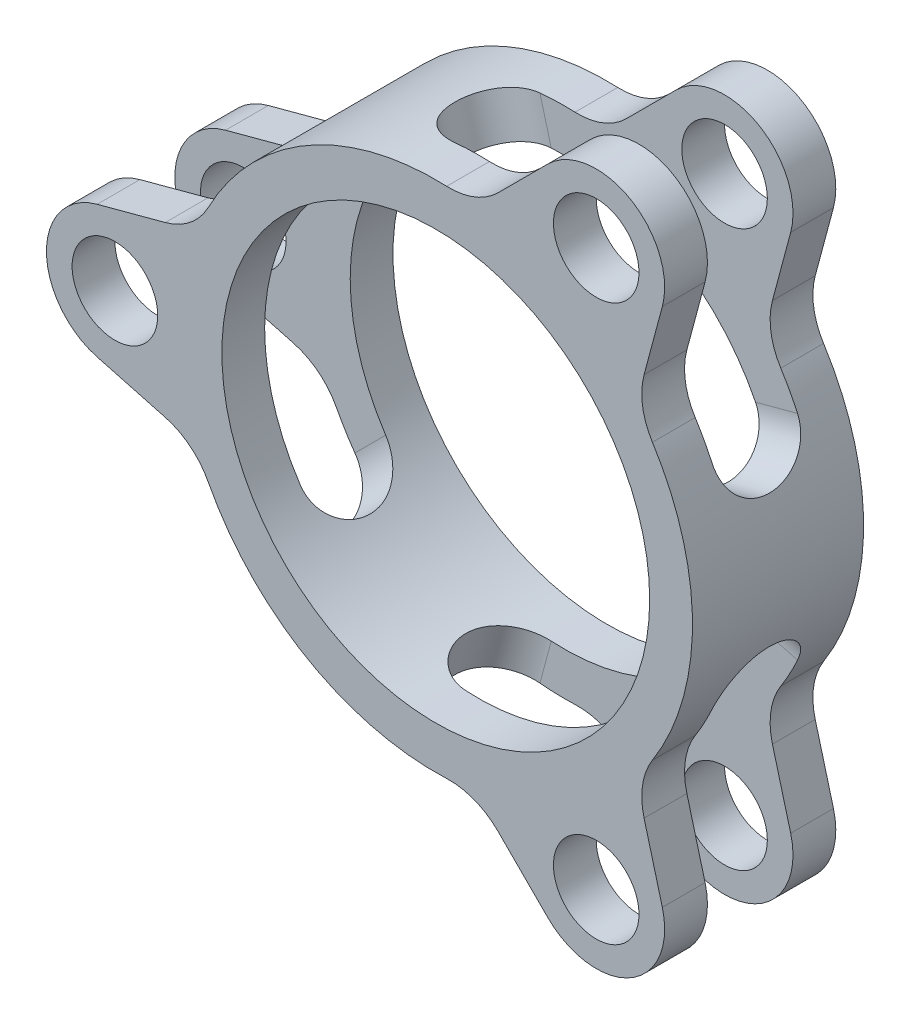
from build123d import *

# Parameters (mm, degrees)
SKETCH1_R               = 30
SKETCH1_R_2             = 25
BOSS_EXTRUDE1_DEPTH     = 10
SKETCH1_5_R             = 5
BOSS_EXTRUDE2_DEPTH     = 10
FILLET1_R               = 8
CUT_EXTRUDE1_DEPTH      = 5
FILLET3_R               = 5
FILLET4_R               = 5
CIRPATTERN1_START       = -10
CIRPATTERN1_OUTLINE_R   = 5
CIRPATTERN1_DEPTH       = 5
CIRPATTERN1_START_2     = 5
CIRPATTERN1_2_OUTLINE_R = 5
CIRPATTERN1_2_DEPTH     = 5
CIRPATTERN1_START_3     = 7.695043188
CIRPATTERN1_3_DEPTH     = 23.304956812
CIRPATTERN1_START_4     = -31
CIRPATTERN1_4_DEPTH     = 22.44392041
CIRPATTERN1_START_5     = 19.696614876
CIRPATTERN1_5_DEPTH     = 11.303385124
CIRPATTERN1_6_DEPTH     = 21.640337448
CIRPATTERN1_START_6     = 19.154924917
CIRPATTERN1_7_DEPTH     = 11.845075083
CIRPATTERN1_START_7     = 6.846405715
CIRPATTERN1_8_DEPTH     = 24.153594285


with BuildPart() as part:
    # Sketch1 → Boss-Extrude1 (new, symmetric)
    with BuildSketch(Plane.XY):
        Circle(SKETCH1_R)
        Circle(SKETCH1_R_2, mode=Mode.SUBTRACT)
    extrude(amount=BOSS_EXTRUDE1_DEPTH, both=True)

    # Sketch1<5> → Boss-Extrude2 (add, symmetric)
    with BuildSketch(Plane.XY):
        with BuildLine():
            ThreePointArc((-27.975291142, -10.83434749), (-30, 0), (-27.975291142, 10.83434749))
            Line((-27.975291142, 10.83434749), (-39.570552361, 7.72740661))
            ThreePointArc((-39.570552361, 7.72740661), (-45.5, 0), (-39.570552361, -7.72740661))
            Line((-39.570552361, -7.72740661), (-27.975291142, -10.83434749))
        make_face()
        with Locations((-37.5, 0)):
            Circle(SKETCH1_5_R, mode=Mode.SUBTRACT)
    extrude(amount=BOSS_EXTRUDE2_DEPTH, both=True)

    # Fillet1
    fillet1_edges = [part.edges().sort_by_distance(p)[0] for p in [
        (-27.975291142, 10.83434749, 0),
        (-27.975291142, -10.83434749, 0),
    ]]
    fillet(fillet1_edges, radius=FILLET1_R)

    # Sketch2 → Cut-Extrude1 (cut, symmetric)
    with BuildSketch(Plane.XY):
        Polygon((0, 0), (-49.927013172, 49.927013172), (-49.927013172, -49.927013172), align=None)
    extrude(amount=CUT_EXTRUDE1_DEPTH, both=True, mode=Mode.SUBTRACT)

    # Fillet3
    fillet3_edges = [part.edges().sort_by_distance(p)[0] for p in [
        (-19.445436483, 19.445436483, -5),
        (-19.445436483, 19.445436483, 5),
    ]]
    fillet(fillet3_edges, radius=FILLET3_R - 0.0001)  # a hair under: the kernel refuses the full size

    # Fillet4
    fillet4_edges = [part.edges().sort_by_distance(p)[0] for p in [
        (-19.445436483, -19.445436483, -5),
        (-19.445436483, -19.445436483, 5),
    ]]
    fillet(fillet4_edges, radius=FILLET4_R - 0.0001)  # a hair under: the kernel refuses the full size

    # CirPattern1: read off the stored shape, not the designer's step
    # CirPattern1 outline → CirPattern1 (add)
    # profile 1 of 2: a face of its own
    with BuildSketch(Plane.XY.offset(CIRPATTERN1_START)):
        with BuildLine():
            ThreePointArc((1.272952374, 29.972981037), (15, 25.980762113), (25.320886818, 16.088899612))
            ThreePointArc((25.320886818, 16.088899612), (24.165509274, 19.166985596), (24.345716693, 22.449825203))
            Line((24.345716693, 22.449825203), (26.47740661, 30.405400281))
            ThreePointArc((26.47740661, 30.405400281), (22.75, 39.404155872), (13.093145751, 38.132806891))
            Line((13.093145751, 38.132806891), (7.26926059, 32.308921731))
            ThreePointArc((7.26926059, 32.308921731), (4.516341804, 30.511437725), (1.272952374, 29.972981037))
        make_face()
        with Locations((18.75, 32.475952642)):
            Circle(CIRPATTERN1_OUTLINE_R, mode=Mode.SUBTRACT)
    # profile 2 of 2: a face of its own
    with BuildSketch(Plane.XY.offset(CIRPATTERN1_START)):
        with BuildLine():
            Line((7.26926059, -32.308921731), (13.093145751, -38.132806891))
            ThreePointArc((13.093145751, -38.132806891), (22.75, -39.404155872), (26.47740661, -30.405400281))
            Line((26.47740661, -30.405400281), (24.345716693, -22.449825203))
            ThreePointArc((24.345716693, -22.449825203), (24.165509274, -19.166985596), (25.320886818, -16.088899612))
            ThreePointArc((25.320886818, -16.088899612), (15, -25.980762113), (1.272952374, -29.972981037))
            ThreePointArc((1.272952374, -29.972981037), (4.516341804, -30.511437725), (7.26926059, -32.308921731))
        make_face()
        with Locations((18.75, -32.475952642)):
            Circle(CIRPATTERN1_OUTLINE_R, mode=Mode.SUBTRACT)
    extrude(amount=CIRPATTERN1_DEPTH)

    # CirPattern1 2 outline → CirPattern1 2 (add)
    # profile 1 of 2: a face of its own
    with BuildSketch(Plane.XY.offset(CIRPATTERN1_START_2)):
        with BuildLine():
            ThreePointArc((1.272952374, 29.972981037), (15, 25.980762113), (25.320886818, 16.088899612))
            ThreePointArc((25.320886818, 16.088899612), (24.165509274, 19.166985596), (24.345716693, 22.449825203))
            Line((24.345716693, 22.449825203), (26.47740661, 30.405400281))
            ThreePointArc((26.47740661, 30.405400281), (22.75, 39.404155872), (13.093145751, 38.132806891))
            Line((13.093145751, 38.132806891), (7.26926059, 32.308921731))
            ThreePointArc((7.26926059, 32.308921731), (4.516341804, 30.511437725), (1.272952374, 29.972981037))
        make_face()
        with Locations((18.75, 32.475952642)):
            Circle(CIRPATTERN1_2_OUTLINE_R, mode=Mode.SUBTRACT)
    # profile 2 of 2: a face of its own
    with BuildSketch(Plane.XY.offset(CIRPATTERN1_START_2)):
        with BuildLine():
            Line((7.26926059, -32.308921731), (13.093145751, -38.132806891))
            ThreePointArc((13.093145751, -38.132806891), (22.75, -39.404155872), (26.47740661, -30.405400281))
            Line((26.47740661, -30.405400281), (24.345716693, -22.449825203))
            ThreePointArc((24.345716693, -22.449825203), (24.165509274, -19.166985596), (25.320886818, -16.088899612))
            ThreePointArc((25.320886818, -16.088899612), (15, -25.980762113), (1.272952374, -29.972981037))
            ThreePointArc((1.272952374, -29.972981037), (4.516341804, -30.511437725), (7.26926059, -32.308921731))
        make_face()
        with Locations((18.75, -32.475952642)):
            Circle(CIRPATTERN1_2_OUTLINE_R, mode=Mode.SUBTRACT)
    extrude(amount=CIRPATTERN1_2_DEPTH)

    # CirPattern1 3 outline → CirPattern1 3 (cut)
    with BuildSketch(Plane(origin=(0, 0, 0), x_dir=(0.25881904510253007, 0.9659258262890659, 0), z_dir=(0.965925826289066, -0.25881904510253, 0)).offset(CIRPATTERN1_START_3)):
        with BuildLine():
            ThreePointArc((-5.000000001, -5), (0, 0), (-5.000000001, 5))
            Line((-5.000000001, 5), (-23, 4.999999996))
            Line((-23, 4.999999996), (-23, -4.999999996))
            Line((-23, -4.999999996), (-5.000000001, -5))
        make_face()
    extrude(amount=CIRPATTERN1_3_DEPTH, mode=Mode.SUBTRACT)

    # CirPattern1 4 outline → CirPattern1 4 (cut)
    with BuildSketch(Plane(origin=(0, 0, 0), x_dir=(0.9659258262890695, 0.25881904510251597, 0), z_dir=(0.25881904510251597, -0.9659258262890696, 0)).offset(CIRPATTERN1_START_4)):
        with BuildLine():
            Line((25, 4.999999996), (5.000000001, 5))
            ThreePointArc((5.000000001, 5), (0, 0), (5.000000001, -5))
            Line((5.000000001, -5), (25, -4.999999996))
            Line((25, -4.999999996), (25, 4.999999996))
        make_face()
    extrude(amount=CIRPATTERN1_4_DEPTH, mode=Mode.SUBTRACT)

    # CirPattern1 5 outline → CirPattern1 5 (cut)
    with BuildSketch(Plane(origin=(0, 0, 0), x_dir=(0.9659258262890695, 0.25881904510251597, 0), z_dir=(0.25881904510251597, -0.9659258262890696, 0)).offset(CIRPATTERN1_START_5)):
        with BuildLine():
            Line((25, 4.999999996), (5.000000001, 5))
            ThreePointArc((5.000000001, 5), (0, 0), (5.000000001, -5))
            Line((5.000000001, -5), (25, -4.999999996))
            Line((25, -4.999999996), (25, 4.999999996))
        make_face()
    extrude(amount=CIRPATTERN1_5_DEPTH, mode=Mode.SUBTRACT)

    # CirPattern1 6 outline → CirPattern1 6 (cut)
    with BuildSketch(Plane(origin=(0, 0, 0), x_dir=(0.9659258262890658, -0.25881904510253, 0), z_dir=(0.25881904510253, 0.965925826289066, 0)).offset(CIRPATTERN1_START_4)):
        with BuildLine():
            ThreePointArc((5.000000007, 5), (0, 0), (5.000000007, -5))
            Line((5.000000007, -5), (25, -4.999999972))
            Line((25, -4.999999972), (25, 4.999999972))
            Line((25, 4.999999972), (5.000000007, 5))
        make_face()
    extrude(amount=CIRPATTERN1_6_DEPTH, mode=Mode.SUBTRACT)

    # CirPattern1 7 outline → CirPattern1 7 (cut)
    with BuildSketch(Plane(origin=(0, 0, 0), x_dir=(0.9659258262890658, -0.25881904510253, 0), z_dir=(0.25881904510253, 0.965925826289066, 0)).offset(CIRPATTERN1_START_6)):
        with BuildLine():
            ThreePointArc((5.000000007, 5), (0, 0), (5.000000007, -5))
            Line((5.000000007, -5), (25, -4.999999972))
            Line((25, -4.999999972), (25, 4.999999972))
            Line((25, 4.999999972), (5.000000007, 5))
        make_face()
    extrude(amount=CIRPATTERN1_7_DEPTH, mode=Mode.SUBTRACT)

    # CirPattern1 8 outline → CirPattern1 8 (cut)
    with BuildSketch(Plane(origin=(0, 0, 0), x_dir=(-0.25881904510251597, 0.9659258262890695, 0), z_dir=(0.9659258262890696, 0.25881904510251597, 0)).offset(CIRPATTERN1_START_7)):
        with BuildLine():
            Line((23, 4.999999975), (5.000000007, 5))
            ThreePointArc((5.000000007, 5), (0, 0), (5.000000007, -5))
            Line((5.000000007, -5), (23, -4.999999975))
            Line((23, -4.999999975), (23, 4.999999975))
        make_face()
    extrude(amount=CIRPATTERN1_8_DEPTH, mode=Mode.SUBTRACT)


solid = part.part
